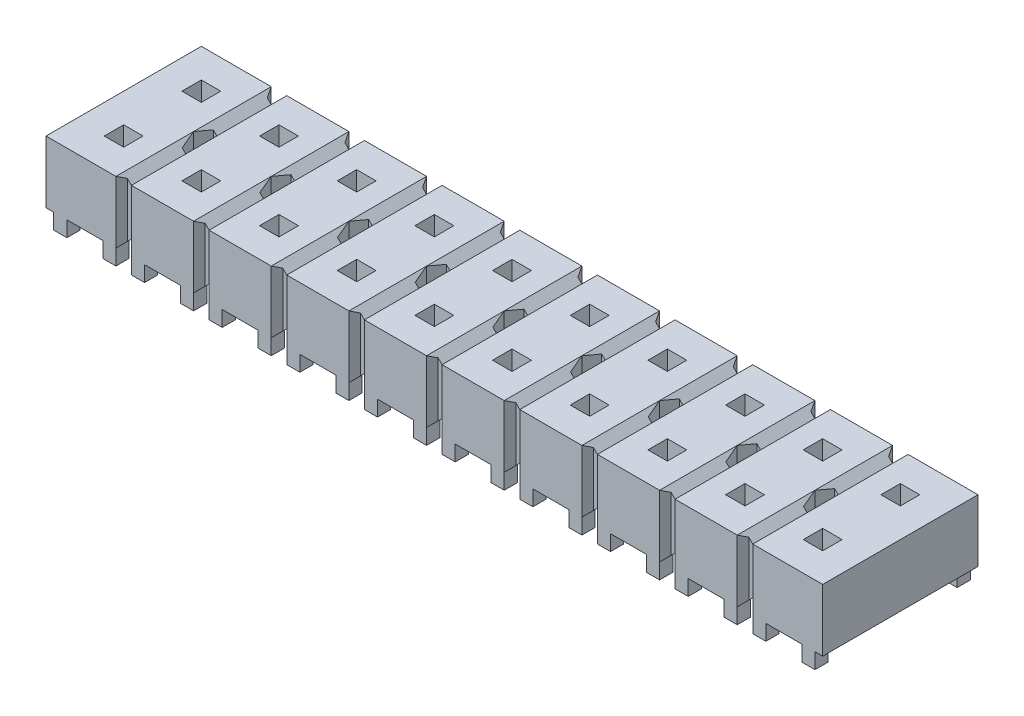
from build123d import *

# Parameters (mm, degrees)
CUT_EXTRUDE1_START     = -2.032
CUT_EXTRUDE1_OUTLINE_W = 0.635
CUT_EXTRUDE1_OUTLINE_H = 0.635
CUT_EXTRUDE1_DEPTH     = 2.032
CUT_EXTRUDE1_START_2   = -4
CUT_EXTRUDE1_2_DEPTH   = 8
SKETCH2_W              = 0.635
SKETCH2_H              = 0.635
CUT_EXTRUDE2_DEPTH     = 14.109943707
SKETCH3_W              = 0.635
SKETCH3_H              = 0.635
CUT_EXTRUDE3_DEPTH     = 14.109943707
SKETCH4_W              = 0.635
SKETCH4_H              = 0.635
CUT_EXTRUDE4_DEPTH     = 14.109943707
SKETCH5_W              = 0.635
SKETCH5_H              = 0.635
CUT_EXTRUDE5_DEPTH     = 14.109943707
SKETCH6_W              = 0.635
SKETCH6_H              = 0.635
CUT_EXTRUDE6_DEPTH     = 14.109943707
SKETCH7_W              = 0.635
SKETCH7_H              = 0.635
CUT_EXTRUDE7_DEPTH     = 14.109943707
SKETCH8_W              = 0.635
SKETCH8_H              = 0.635
CUT_EXTRUDE8_DEPTH     = 14.109943707
SKETCH9_W              = 0.635
SKETCH9_H              = 0.635
CUT_EXTRUDE9_DEPTH     = 14.109943707
SKETCH10_W             = 0.635
SKETCH10_H             = 0.635
CUT_EXTRUDE10_DEPTH    = 14.109943707
SKETCH11_W             = 0.635
SKETCH11_H             = 0.635
CUT_EXTRUDE11_DEPTH    = 14.109943707
SKETCH12_W             = 0.635
SKETCH12_H             = 0.635
CUT_EXTRUDE12_DEPTH    = 14.109943707
SKETCH13_W             = 0.635
SKETCH13_H             = 0.635
CUT_EXTRUDE13_DEPTH    = 14.109943707
SKETCH14_W             = 0.635
SKETCH14_H             = 0.635
CUT_EXTRUDE14_DEPTH    = 14.109943707
SKETCH15_W             = 0.635
SKETCH15_H             = 0.635
CUT_EXTRUDE15_DEPTH    = 14.109943707
SKETCH16_W             = 0.635
SKETCH16_H             = 0.635
CUT_EXTRUDE16_DEPTH    = 14.109943707
SKETCH17_W             = 0.635
SKETCH17_H             = 0.635
CUT_EXTRUDE17_DEPTH    = 14.109943707
SKETCH18_W             = 0.635
SKETCH18_H             = 0.635
CUT_EXTRUDE18_DEPTH    = 14.109943707
SKETCH19_W             = 0.635
SKETCH19_H             = 0.635
CUT_EXTRUDE19_DEPTH    = 14.109943707
SKETCH20_W             = 0.635
SKETCH20_H             = 0.635
CUT_EXTRUDE20_DEPTH    = 14.109943707
SKETCH21_W             = 0.428684182
SKETCH21_H             = 0.508
BOSS_EXTRUDE1_DEPTH    = 0.4318
SKETCH22_W             = 0.431799746
SKETCH22_H             = 0.4318
BOSS_EXTRUDE2_DEPTH    = 0.508
SKETCH23_W             = 0.428684182
SKETCH23_H             = 0.508
BOSS_EXTRUDE3_DEPTH    = 0.4318
SKETCH24_W             = 0.431799746
SKETCH24_H             = 0.4318
BOSS_EXTRUDE4_DEPTH    = 0.508
SKETCH25_W             = 0.428684182
SKETCH25_H             = 0.508
BOSS_EXTRUDE5_DEPTH    = 0.4318
SKETCH26_W             = 0.428683928
SKETCH26_H             = 0.508
BOSS_EXTRUDE6_DEPTH    = 0.4318
SKETCH27_W             = 0.428684182
SKETCH27_H             = 0.508
BOSS_EXTRUDE7_DEPTH    = 0.4318
SKETCH28_W             = 0.428683928
SKETCH28_H             = 0.508
BOSS_EXTRUDE8_DEPTH    = 0.4318
SKETCH29_W             = 0.428684182
SKETCH29_H             = 0.508
BOSS_EXTRUDE9_DEPTH    = 0.4318
SKETCH30_W             = 0.428683928
SKETCH30_H             = 0.508
BOSS_EXTRUDE10_DEPTH   = 0.4318
SKETCH31_W             = 0.428684182
SKETCH31_H             = 0.508
BOSS_EXTRUDE11_DEPTH   = 0.4318
SKETCH32_W             = 0.428683928
SKETCH32_H             = 0.508
BOSS_EXTRUDE12_DEPTH   = 0.4318
SKETCH33_W             = 0.428684182
SKETCH33_H             = 0.508
BOSS_EXTRUDE13_DEPTH   = 0.4318
SKETCH34_W             = 0.428683928
SKETCH34_H             = 0.508
BOSS_EXTRUDE14_DEPTH   = 0.4318
SKETCH35_W             = 0.428684182
SKETCH35_H             = 0.508
BOSS_EXTRUDE15_DEPTH   = 0.4318
SKETCH36_W             = 0.428683928
SKETCH36_H             = 0.508
BOSS_EXTRUDE16_DEPTH   = 0.4318
SKETCH37_W             = 0.428684182
SKETCH37_H             = 0.508
BOSS_EXTRUDE17_DEPTH   = 0.4318
SKETCH38_W             = 0.428683928
SKETCH38_H             = 0.508
BOSS_EXTRUDE18_DEPTH   = 0.4318
SKETCH39_W             = 0.428684182
SKETCH39_H             = 0.508
BOSS_EXTRUDE19_DEPTH   = 0.4318
SKETCH40_W             = 0.428683928
SKETCH40_H             = 0.508
BOSS_EXTRUDE20_DEPTH   = 0.4318
SKETCH41_W             = 0.428684182
SKETCH41_H             = 0.508
BOSS_EXTRUDE21_DEPTH   = 0.4318
SKETCH42_W             = 0.428683928
SKETCH42_H             = 0.508
BOSS_EXTRUDE22_DEPTH   = 0.4318
SKETCH43_W             = 0.428684182
SKETCH43_H             = 0.508
BOSS_EXTRUDE23_DEPTH   = 0.4318
SKETCH44_W             = 0.428683928
SKETCH44_H             = 0.508
BOSS_EXTRUDE24_DEPTH   = 0.4318
SKETCH45_W             = 0.428684182
SKETCH45_H             = 0.508
BOSS_EXTRUDE25_DEPTH   = 0.4318
SKETCH46_W             = 0.428683928
SKETCH46_H             = 0.508
BOSS_EXTRUDE26_DEPTH   = 0.4318
SKETCH47_W             = 0.428684182
SKETCH47_H             = 0.508
BOSS_EXTRUDE27_DEPTH   = 0.4318
SKETCH48_W             = 0.428683928
SKETCH48_H             = 0.508
BOSS_EXTRUDE28_DEPTH   = 0.4318
SKETCH49_W             = 0.428684182
SKETCH49_H             = 0.508
BOSS_EXTRUDE29_DEPTH   = 0.4318
SKETCH50_W             = 0.428683928
SKETCH50_H             = 0.508
BOSS_EXTRUDE30_DEPTH   = 0.4318
SKETCH51_W             = 0.428684182
SKETCH51_H             = 0.508
BOSS_EXTRUDE31_DEPTH   = 0.4318
SKETCH52_W             = 0.428683928
SKETCH52_H             = 0.508
BOSS_EXTRUDE32_DEPTH   = 0.4318
SKETCH53_W             = 0.428684182
SKETCH53_H             = 0.508
BOSS_EXTRUDE33_DEPTH   = 0.4318
SKETCH54_W             = 0.428683928
SKETCH54_H             = 0.508
BOSS_EXTRUDE34_DEPTH   = 0.4318
SKETCH55_W             = 0.428684182
SKETCH55_H             = 0.508
BOSS_EXTRUDE35_DEPTH   = 0.4318
SKETCH56_W             = 0.428683928
SKETCH56_H             = 0.508
BOSS_EXTRUDE36_DEPTH   = 0.4318
SKETCH57_W             = 0.4318
SKETCH57_H             = 0.4318
BOSS_EXTRUDE37_DEPTH   = 0.508
SKETCH58_W             = 0.428683928
SKETCH58_H             = 0.508
BOSS_EXTRUDE38_DEPTH   = 0.4318
SKETCH59_W             = 0.428683928
SKETCH59_H             = 0.508
BOSS_EXTRUDE39_DEPTH   = 0.4318
SKETCH60_W             = 0.4318
SKETCH60_H             = 0.4318
BOSS_EXTRUDE40_DEPTH   = 0.508
CHAMFER1_SIZE          = 0.296816803
CHAMFER1_EDGE_2_SIZE   = 0.296816803
CHAMFER1_EDGE_3_SIZE   = 0.296816803
CHAMFER1_EDGE_4_SIZE   = 0.296816803
CHAMFER1_EDGE_5_SIZE   = 0.296816803
CHAMFER1_EDGE_6_SIZE   = 0.296816803
CHAMFER1_EDGE_7_SIZE   = 0.296816803
CHAMFER1_EDGE_8_SIZE   = 0.296816803
CHAMFER1_EDGE_9_SIZE   = 0.296816803
CHAMFER1_EDGE_10_SIZE  = 0.296816803
CHAMFER1_EDGE_11_SIZE  = 0.296816803
CHAMFER1_EDGE_12_SIZE  = 0.296816803
CHAMFER1_EDGE_13_SIZE  = 0.296816803
CHAMFER1_EDGE_14_SIZE  = 0.296816803
CHAMFER1_EDGE_15_SIZE  = 0.296816803
CHAMFER1_EDGE_16_SIZE  = 0.296816803
CHAMFER1_EDGE_17_SIZE  = 0.296816803
CHAMFER1_EDGE_18_SIZE  = 0.296816803


with BuildPart() as part:
    # Cut-Extrude1: read off the stored shape, not the designer's step
    # Cut-Extrude1 outline → Cut-Extrude1 (new body)
    with BuildSketch(Plane(origin=(0, 2.54, 0), x_dir=(-1, 0, 0), z_dir=(0, 1, 0)).offset(CUT_EXTRUDE1_START)):
        Polygon((-10.414, 2.54), (-12.7, 2.54), (-12.7, -2.54), (-10.414, -2.54), (-10.16, -2.019222824), (-9.906, -2.54), (-7.874, -2.54), (-7.62, -2.019222824), (-7.366, -2.54), (-5.334, -2.54), (-5.08, -2.019222824), (-4.826, -2.54), (-2.794, -2.54), (-2.54, -2.019222824), (-2.286, -2.54), (-0.254, -2.54), (0, -2.019222824), (0.254, -2.54), (2.286, -2.54), (2.54, -2.019222824), (2.794, -2.54), (4.826, -2.54), (5.08, -2.019222824), (5.334, -2.54), (7.366, -2.54), (7.62, -2.019222824), (7.874, -2.54), (9.906, -2.54), (10.16, -2.019222824), (10.414, -2.54), (12.7, -2.54), (12.7, 2.54), (10.414, 2.54), (10.16, 2.019222824), (9.906, 2.54), (7.874, 2.54), (7.62, 2.019222824), (7.366, 2.54), (5.334, 2.54), (5.08, 2.019222824), (4.826, 2.54), (2.794, 2.54), (2.54, 2.019222824), (2.286, 2.54), (0.254, 2.54), (0, 2.019222824), (-0.254, 2.54), (-2.286, 2.54), (-2.54, 2.019222824), (-2.794, 2.54), (-4.826, 2.54), (-5.08, 2.019222824), (-5.334, 2.54), (-7.366, 2.54), (-7.62, 2.019222824), (-7.874, 2.54), (-9.906, 2.54), (-10.16, 2.019222824), align=None)
        Polygon((-10.414, 0), (-10.276840001, 0.508), (-10.043159999, 0.508), (-9.906, 0), (-10.043159999, -0.508), (-10.276840001, -0.508), align=None, mode=Mode.SUBTRACT)
        Polygon((-7.874, 0), (-7.736840001, 0.508), (-7.503159999, 0.508), (-7.366, 0), (-7.503159999, -0.508), (-7.736840001, -0.508), align=None, mode=Mode.SUBTRACT)
        Polygon((-5.334, 0), (-5.196840001, 0.508), (-4.963159999, 0.508), (-4.826, 0), (-4.963159999, -0.508), (-5.196840001, -0.508), align=None, mode=Mode.SUBTRACT)
        Polygon((-2.794, 0), (-2.656840001, 0.508), (-2.423159999, 0.508), (-2.286, 0), (-2.423159999, -0.508), (-2.656840001, -0.508), align=None, mode=Mode.SUBTRACT)
        Polygon((-0.254, 0), (-0.116840001, 0.508), (0.116840001, 0.508), (0.254, 0), (0.116840001, -0.508), (-0.116840001, -0.508), align=None, mode=Mode.SUBTRACT)
        Polygon((2.286, 0), (2.423159999, 0.508), (2.656840001, 0.508), (2.794, 0), (2.656840001, -0.508), (2.423159999, -0.508), align=None, mode=Mode.SUBTRACT)
        Polygon((4.826, 0), (4.963159999, 0.508), (5.196840001, 0.508), (5.334, 0), (5.196840001, -0.508), (4.963159999, -0.508), align=None, mode=Mode.SUBTRACT)
        Polygon((7.366, 0), (7.503159999, 0.508), (7.736840001, 0.508), (7.874, 0), (7.736840001, -0.508), (7.503159999, -0.508), align=None, mode=Mode.SUBTRACT)
        Polygon((10.043159999, 0.508), (10.276840001, 0.508), (10.414, 0), (10.276840001, -0.508), (10.043159999, -0.508), (9.906, 0), align=None, mode=Mode.SUBTRACT)
        with Locations((11.43, 1.27)):
            Rectangle(CUT_EXTRUDE1_OUTLINE_W, CUT_EXTRUDE1_OUTLINE_H, mode=Mode.SUBTRACT)
    extrude(amount=CUT_EXTRUDE1_DEPTH)

    # Cut-Extrude1 2 outline → Cut-Extrude1 2 (cut)
    with BuildSketch(Plane.XY.offset(CUT_EXTRUDE1_START_2)):
        Polygon((10.16, 0.762), (9.906, 0.508), (10.414, 0.508), align=None)
        Polygon((7.62, 0.762), (7.366, 0.508), (7.874, 0.508), align=None)
        Polygon((5.08, 0.762), (4.826, 0.508), (5.334, 0.508), align=None)
        Polygon((2.54, 0.762), (2.286, 0.508), (2.794, 0.508), align=None)
        Polygon((0, 0.762), (-0.254, 0.508), (0.254, 0.508), align=None)
        Polygon((-2.54, 0.762), (-2.794, 0.508), (-2.286, 0.508), align=None)
        Polygon((-5.08, 0.762), (-5.334, 0.508), (-4.826, 0.508), align=None)
        Polygon((-7.62, 0.762), (-7.874, 0.508), (-7.366, 0.508), align=None)
        Polygon((-10.16, 0.762), (-10.414, 0.508), (-9.906, 0.508), align=None)
        Polygon((-10.16, 2.286), (-9.906, 2.54), (-10.414, 2.54), align=None)
        Polygon((10.414, 2.54), (9.906, 2.54), (10.16, 2.286), align=None)
        Polygon((7.874, 2.54), (7.366, 2.54), (7.62, 2.286), align=None)
        Polygon((5.334, 2.54), (4.826, 2.54), (5.08, 2.286), align=None)
        Polygon((2.794, 2.54), (2.286, 2.54), (2.54, 2.286), align=None)
        Polygon((0.254, 2.54), (-0.254, 2.54), (0, 2.286), align=None)
        Polygon((-2.286, 2.54), (-2.794, 2.54), (-2.54, 2.286), align=None)
        Polygon((-4.826, 2.54), (-5.334, 2.54), (-5.08, 2.286), align=None)
        Polygon((-7.874, 2.54), (-7.62, 2.286), (-7.366, 2.54), align=None)
    extrude(amount=CUT_EXTRUDE1_2_DEPTH, mode=Mode.SUBTRACT)

    # Sketch2 → Cut-Extrude2 (cut, through all)
    with BuildSketch(Plane.XZ.offset(-0.508)):
        with Locations((-11.43, -1.27)):
            Rectangle(SKETCH2_W, SKETCH2_H)
    extrude(amount=-CUT_EXTRUDE2_DEPTH, mode=Mode.SUBTRACT)

    # Sketch3 → Cut-Extrude3 (cut, through all)
    with BuildSketch(Plane.XZ.offset(-0.508)):
        with Locations((-8.89, 1.27)):
            Rectangle(SKETCH3_W, SKETCH3_H)
    extrude(amount=-CUT_EXTRUDE3_DEPTH, mode=Mode.SUBTRACT)

    # Sketch4 → Cut-Extrude4 (cut, through all)
    with BuildSketch(Plane(origin=(0, 2.54, 0), x_dir=(-1, 0, 0), z_dir=(0, 1, 0))):
        with Locations((8.89, -1.27)):
            Rectangle(SKETCH4_W, SKETCH4_H)
    extrude(amount=-CUT_EXTRUDE4_DEPTH, mode=Mode.SUBTRACT)

    # Sketch5 → Cut-Extrude5 (cut, through all)
    with BuildSketch(Plane.XZ.offset(-0.508)):
        with Locations((-6.35, 1.27)):
            Rectangle(SKETCH5_W, SKETCH5_H)
    extrude(amount=-CUT_EXTRUDE5_DEPTH, mode=Mode.SUBTRACT)

    # Sketch6 → Cut-Extrude6 (cut, through all)
    with BuildSketch(Plane(origin=(0, 2.54, 0), x_dir=(-1, 0, 0), z_dir=(0, 1, 0))):
        with Locations((6.35, -1.27)):
            Rectangle(SKETCH6_W, SKETCH6_H)
    extrude(amount=-CUT_EXTRUDE6_DEPTH, mode=Mode.SUBTRACT)

    # Sketch7 → Cut-Extrude7 (cut, through all)
    with BuildSketch(Plane.XZ.offset(-0.508)):
        with Locations((-3.81, 1.27)):
            Rectangle(SKETCH7_W, SKETCH7_H)
    extrude(amount=-CUT_EXTRUDE7_DEPTH, mode=Mode.SUBTRACT)

    # Sketch8 → Cut-Extrude8 (cut, through all)
    with BuildSketch(Plane(origin=(0, 2.54, 0), x_dir=(-1, 0, 0), z_dir=(0, 1, 0))):
        with Locations((3.81, -1.27)):
            Rectangle(SKETCH8_W, SKETCH8_H)
    extrude(amount=-CUT_EXTRUDE8_DEPTH, mode=Mode.SUBTRACT)

    # Sketch9 → Cut-Extrude9 (cut, through all)
    with BuildSketch(Plane.XZ.offset(-0.508)):
        with Locations((-1.27, 1.27)):
            Rectangle(SKETCH9_W, SKETCH9_H)
    extrude(amount=-CUT_EXTRUDE9_DEPTH, mode=Mode.SUBTRACT)

    # Sketch10 → Cut-Extrude10 (cut, through all)
    with BuildSketch(Plane(origin=(0, 2.54, 0), x_dir=(-1, 0, 0), z_dir=(0, 1, 0))):
        with Locations((1.27, -1.27)):
            Rectangle(SKETCH10_W, SKETCH10_H)
    extrude(amount=-CUT_EXTRUDE10_DEPTH, mode=Mode.SUBTRACT)

    # Sketch11 → Cut-Extrude11 (cut, through all)
    with BuildSketch(Plane.XZ.offset(-0.508)):
        with Locations((1.27, 1.27)):
            Rectangle(SKETCH11_W, SKETCH11_H)
    extrude(amount=-CUT_EXTRUDE11_DEPTH, mode=Mode.SUBTRACT)

    # Sketch12 → Cut-Extrude12 (cut, through all)
    with BuildSketch(Plane(origin=(0, 2.54, 0), x_dir=(-1, 0, 0), z_dir=(0, 1, 0))):
        with Locations((-1.27, -1.27)):
            Rectangle(SKETCH12_W, SKETCH12_H)
    extrude(amount=-CUT_EXTRUDE12_DEPTH, mode=Mode.SUBTRACT)

    # Sketch13 → Cut-Extrude13 (cut, through all)
    with BuildSketch(Plane.XZ.offset(-0.508)):
        with Locations((3.81, 1.27)):
            Rectangle(SKETCH13_W, SKETCH13_H)
    extrude(amount=-CUT_EXTRUDE13_DEPTH, mode=Mode.SUBTRACT)

    # Sketch14 → Cut-Extrude14 (cut, through all)
    with BuildSketch(Plane(origin=(0, 2.54, 0), x_dir=(-1, 0, 0), z_dir=(0, 1, 0))):
        with Locations((-3.81, -1.27)):
            Rectangle(SKETCH14_W, SKETCH14_H)
    extrude(amount=-CUT_EXTRUDE14_DEPTH, mode=Mode.SUBTRACT)

    # Sketch15 → Cut-Extrude15 (cut, through all)
    with BuildSketch(Plane.XZ.offset(-0.508)):
        with Locations((6.35, 1.27)):
            Rectangle(SKETCH15_W, SKETCH15_H)
    extrude(amount=-CUT_EXTRUDE15_DEPTH, mode=Mode.SUBTRACT)

    # Sketch16 → Cut-Extrude16 (cut, through all)
    with BuildSketch(Plane(origin=(0, 2.54, 0), x_dir=(-1, 0, 0), z_dir=(0, 1, 0))):
        with Locations((-6.35, -1.27)):
            Rectangle(SKETCH16_W, SKETCH16_H)
    extrude(amount=-CUT_EXTRUDE16_DEPTH, mode=Mode.SUBTRACT)

    # Sketch17 → Cut-Extrude17 (cut, through all)
    with BuildSketch(Plane.XZ.offset(-0.508)):
        with Locations((8.89, 1.27)):
            Rectangle(SKETCH17_W, SKETCH17_H)
    extrude(amount=-CUT_EXTRUDE17_DEPTH, mode=Mode.SUBTRACT)

    # Sketch18 → Cut-Extrude18 (cut, through all)
    with BuildSketch(Plane(origin=(0, 2.54, 0), x_dir=(-1, 0, 0), z_dir=(0, 1, 0))):
        with Locations((-8.89, -1.27)):
            Rectangle(SKETCH18_W, SKETCH18_H)
    extrude(amount=-CUT_EXTRUDE18_DEPTH, mode=Mode.SUBTRACT)

    # Sketch19 → Cut-Extrude19 (cut, through all)
    with BuildSketch(Plane.XZ.offset(-0.508)):
        with Locations((11.43, 1.27)):
            Rectangle(SKETCH19_W, SKETCH19_H)
    extrude(amount=-CUT_EXTRUDE19_DEPTH, mode=Mode.SUBTRACT)

    # Sketch20 → Cut-Extrude20 (cut, through all)
    with BuildSketch(Plane(origin=(0, 2.54, 0), x_dir=(-1, 0, 0), z_dir=(0, 1, 0))):
        with Locations((-11.43, -1.27)):
            Rectangle(SKETCH20_W, SKETCH20_H)
    extrude(amount=-CUT_EXTRUDE20_DEPTH, mode=Mode.SUBTRACT)

    # Sketch21 → Boss-Extrude1 (add)
    with BuildSketch(Plane(origin=(0, 0, -2.54), x_dir=(-1, 0, 0), z_dir=(0, 0, -1))):
        with Locations((-10.628342091, 0.254)):
            Rectangle(SKETCH21_W, SKETCH21_H)
    extrude(amount=-BOSS_EXTRUDE1_DEPTH)

    # Sketch22 → Boss-Extrude2 (add)
    with BuildSketch(Plane.XZ.offset(-0.508)):
        with Locations((12.233215945, 2.3241)):
            Rectangle(SKETCH22_W, SKETCH22_H)
    extrude(amount=BOSS_EXTRUDE2_DEPTH)

    # Sketch23 → Boss-Extrude3 (add)
    with BuildSketch(Plane.XY.offset(2.54)):
        with Locations((10.628342091, 0.254)):
            Rectangle(SKETCH23_W, SKETCH23_H)
    extrude(amount=-BOSS_EXTRUDE3_DEPTH)

    # Sketch24 → Boss-Extrude4 (add)
    with BuildSketch(Plane.XZ.offset(-0.508)):
        with Locations((12.233215945, -2.3241)):
            Rectangle(SKETCH24_W, SKETCH24_H)
    extrude(amount=BOSS_EXTRUDE4_DEPTH)

    # Sketch25 → Boss-Extrude5 (add)
    with BuildSketch(Plane(origin=(0, 0, -2.54), x_dir=(-1, 0, 0), z_dir=(0, 0, -1))):
        with Locations((-8.088342091, 0.254)):
            Rectangle(SKETCH25_W, SKETCH25_H)
    extrude(amount=-BOSS_EXTRUDE5_DEPTH)

    # Sketch26 → Boss-Extrude6 (add)
    with BuildSketch(Plane.XY.offset(2.54)):
        with Locations((9.691658036, 0.254)):
            Rectangle(SKETCH26_W, SKETCH26_H)
    extrude(amount=-BOSS_EXTRUDE6_DEPTH)

    # Sketch27 → Boss-Extrude7 (add)
    with BuildSketch(Plane.XY.offset(2.54)):
        with Locations((8.088342091, 0.254)):
            Rectangle(SKETCH27_W, SKETCH27_H)
    extrude(amount=-BOSS_EXTRUDE7_DEPTH)

    # Sketch28 → Boss-Extrude8 (add)
    with BuildSketch(Plane(origin=(0, 0, -2.54), x_dir=(-1, 0, 0), z_dir=(0, 0, -1))):
        with Locations((-9.691658036, 0.254)):
            Rectangle(SKETCH28_W, SKETCH28_H)
    extrude(amount=-BOSS_EXTRUDE8_DEPTH)

    # Sketch29 → Boss-Extrude9 (add)
    with BuildSketch(Plane(origin=(0, 0, -2.54), x_dir=(-1, 0, 0), z_dir=(0, 0, -1))):
        with Locations((-5.548342091, 0.254)):
            Rectangle(SKETCH29_W, SKETCH29_H)
    extrude(amount=-BOSS_EXTRUDE9_DEPTH)

    # Sketch30 → Boss-Extrude10 (add)
    with BuildSketch(Plane.XY.offset(2.54)):
        with Locations((7.151658036, 0.254)):
            Rectangle(SKETCH30_W, SKETCH30_H)
    extrude(amount=-BOSS_EXTRUDE10_DEPTH)

    # Sketch31 → Boss-Extrude11 (add)
    with BuildSketch(Plane.XY.offset(2.54)):
        with Locations((5.548342091, 0.254)):
            Rectangle(SKETCH31_W, SKETCH31_H)
    extrude(amount=-BOSS_EXTRUDE11_DEPTH)

    # Sketch32 → Boss-Extrude12 (add)
    with BuildSketch(Plane(origin=(0, 0, -2.54), x_dir=(-1, 0, 0), z_dir=(0, 0, -1))):
        with Locations((-7.151658036, 0.254)):
            Rectangle(SKETCH32_W, SKETCH32_H)
    extrude(amount=-BOSS_EXTRUDE12_DEPTH)

    # Sketch33 → Boss-Extrude13 (add)
    with BuildSketch(Plane(origin=(0, 0, -2.54), x_dir=(-1, 0, 0), z_dir=(0, 0, -1))):
        with Locations((-3.008342091, 0.254)):
            Rectangle(SKETCH33_W, SKETCH33_H)
    extrude(amount=-BOSS_EXTRUDE13_DEPTH)

    # Sketch34 → Boss-Extrude14 (add)
    with BuildSketch(Plane.XY.offset(2.54)):
        with Locations((4.611658036, 0.254)):
            Rectangle(SKETCH34_W, SKETCH34_H)
    extrude(amount=-BOSS_EXTRUDE14_DEPTH)

    # Sketch35 → Boss-Extrude15 (add)
    with BuildSketch(Plane.XY.offset(2.54)):
        with Locations((3.008342091, 0.254)):
            Rectangle(SKETCH35_W, SKETCH35_H)
    extrude(amount=-BOSS_EXTRUDE15_DEPTH)

    # Sketch36 → Boss-Extrude16 (add)
    with BuildSketch(Plane(origin=(0, 0, -2.54), x_dir=(-1, 0, 0), z_dir=(0, 0, -1))):
        with Locations((-4.611658036, 0.254)):
            Rectangle(SKETCH36_W, SKETCH36_H)
    extrude(amount=-BOSS_EXTRUDE16_DEPTH)

    # Sketch37 → Boss-Extrude17 (add)
    with BuildSketch(Plane(origin=(0, 0, -2.54), x_dir=(-1, 0, 0), z_dir=(0, 0, -1))):
        with Locations((-0.468342091, 0.254)):
            Rectangle(SKETCH37_W, SKETCH37_H)
    extrude(amount=-BOSS_EXTRUDE17_DEPTH)

    # Sketch38 → Boss-Extrude18 (add)
    with BuildSketch(Plane.XY.offset(2.54)):
        with Locations((2.071658036, 0.254)):
            Rectangle(SKETCH38_W, SKETCH38_H)
    extrude(amount=-BOSS_EXTRUDE18_DEPTH)

    # Sketch39 → Boss-Extrude19 (add)
    with BuildSketch(Plane.XY.offset(2.54)):
        with Locations((0.468342091, 0.254)):
            Rectangle(SKETCH39_W, SKETCH39_H)
    extrude(amount=-BOSS_EXTRUDE19_DEPTH)

    # Sketch40 → Boss-Extrude20 (add)
    with BuildSketch(Plane(origin=(0, 0, -2.54), x_dir=(-1, 0, 0), z_dir=(0, 0, -1))):
        with Locations((-2.071658036, 0.254)):
            Rectangle(SKETCH40_W, SKETCH40_H)
    extrude(amount=-BOSS_EXTRUDE20_DEPTH)

    # Sketch41 → Boss-Extrude21 (add)
    with BuildSketch(Plane(origin=(0, 0, -2.54), x_dir=(-1, 0, 0), z_dir=(0, 0, -1))):
        with Locations((2.071657909, 0.254)):
            Rectangle(SKETCH41_W, SKETCH41_H)
    extrude(amount=-BOSS_EXTRUDE21_DEPTH)

    # Sketch42 → Boss-Extrude22 (add)
    with BuildSketch(Plane.XY.offset(2.54)):
        with Locations((-0.468341964, 0.254)):
            Rectangle(SKETCH42_W, SKETCH42_H)
    extrude(amount=-BOSS_EXTRUDE22_DEPTH)

    # Sketch43 → Boss-Extrude23 (add)
    with BuildSketch(Plane.XY.offset(2.54)):
        with Locations((-2.071657909, 0.254)):
            Rectangle(SKETCH43_W, SKETCH43_H)
    extrude(amount=-BOSS_EXTRUDE23_DEPTH)

    # Sketch44 → Boss-Extrude24 (add)
    with BuildSketch(Plane(origin=(0, 0, -2.54), x_dir=(-1, 0, 0), z_dir=(0, 0, -1))):
        with Locations((0.468341964, 0.254)):
            Rectangle(SKETCH44_W, SKETCH44_H)
    extrude(amount=-BOSS_EXTRUDE24_DEPTH)

    # Sketch45 → Boss-Extrude25 (add)
    with BuildSketch(Plane(origin=(0, 0, -2.54), x_dir=(-1, 0, 0), z_dir=(0, 0, -1))):
        with Locations((4.611657909, 0.254)):
            Rectangle(SKETCH45_W, SKETCH45_H)
    extrude(amount=-BOSS_EXTRUDE25_DEPTH)

    # Sketch46 → Boss-Extrude26 (add)
    with BuildSketch(Plane.XY.offset(2.54)):
        with Locations((-3.008341964, 0.254)):
            Rectangle(SKETCH46_W, SKETCH46_H)
    extrude(amount=-BOSS_EXTRUDE26_DEPTH)

    # Sketch47 → Boss-Extrude27 (add)
    with BuildSketch(Plane.XY.offset(2.54)):
        with Locations((-4.611657909, 0.254)):
            Rectangle(SKETCH47_W, SKETCH47_H)
    extrude(amount=-BOSS_EXTRUDE27_DEPTH)

    # Sketch48 → Boss-Extrude28 (add)
    with BuildSketch(Plane(origin=(0, 0, -2.54), x_dir=(-1, 0, 0), z_dir=(0, 0, -1))):
        with Locations((3.008341964, 0.254)):
            Rectangle(SKETCH48_W, SKETCH48_H)
    extrude(amount=-BOSS_EXTRUDE28_DEPTH)

    # Sketch49 → Boss-Extrude29 (add)
    with BuildSketch(Plane(origin=(0, 0, -2.54), x_dir=(-1, 0, 0), z_dir=(0, 0, -1))):
        with Locations((7.151657909, 0.254)):
            Rectangle(SKETCH49_W, SKETCH49_H)
    extrude(amount=-BOSS_EXTRUDE29_DEPTH)

    # Sketch50 → Boss-Extrude30 (add)
    with BuildSketch(Plane.XY.offset(2.54)):
        with Locations((-5.548341964, 0.254)):
            Rectangle(SKETCH50_W, SKETCH50_H)
    extrude(amount=-BOSS_EXTRUDE30_DEPTH)

    # Sketch51 → Boss-Extrude31 (add)
    with BuildSketch(Plane.XY.offset(2.54)):
        with Locations((-7.151657909, 0.254)):
            Rectangle(SKETCH51_W, SKETCH51_H)
    extrude(amount=-BOSS_EXTRUDE31_DEPTH)

    # Sketch52 → Boss-Extrude32 (add)
    with BuildSketch(Plane(origin=(0, 0, -2.54), x_dir=(-1, 0, 0), z_dir=(0, 0, -1))):
        with Locations((5.548341964, 0.254)):
            Rectangle(SKETCH52_W, SKETCH52_H)
    extrude(amount=-BOSS_EXTRUDE32_DEPTH)

    # Sketch53 → Boss-Extrude33 (add)
    with BuildSketch(Plane(origin=(0, 0, -2.54), x_dir=(-1, 0, 0), z_dir=(0, 0, -1))):
        with Locations((9.691657909, 0.254)):
            Rectangle(SKETCH53_W, SKETCH53_H)
    extrude(amount=-BOSS_EXTRUDE33_DEPTH)

    # Sketch54 → Boss-Extrude34 (add)
    with BuildSketch(Plane.XY.offset(2.54)):
        with Locations((-8.088341964, 0.254)):
            Rectangle(SKETCH54_W, SKETCH54_H)
    extrude(amount=-BOSS_EXTRUDE34_DEPTH)

    # Sketch55 → Boss-Extrude35 (add)
    with BuildSketch(Plane.XY.offset(2.54)):
        with Locations((-9.691657909, 0.254)):
            Rectangle(SKETCH55_W, SKETCH55_H)
    extrude(amount=-BOSS_EXTRUDE35_DEPTH)

    # Sketch56 → Boss-Extrude36 (add)
    with BuildSketch(Plane(origin=(0, 0, -2.54), x_dir=(-1, 0, 0), z_dir=(0, 0, -1))):
        with Locations((8.088341964, 0.254)):
            Rectangle(SKETCH56_W, SKETCH56_H)
    extrude(amount=-BOSS_EXTRUDE36_DEPTH)

    # Sketch57 → Boss-Extrude37 (add)
    with BuildSketch(Plane.XZ.offset(-0.508)):
        with Locations((-12.233215818, 2.3241)):
            Rectangle(SKETCH57_W, SKETCH57_H)
    extrude(amount=BOSS_EXTRUDE37_DEPTH)

    # Sketch58 → Boss-Extrude38 (add)
    with BuildSketch(Plane.XY.offset(2.54)):
        with Locations((-10.628341964, 0.254)):
            Rectangle(SKETCH58_W, SKETCH58_H)
    extrude(amount=-BOSS_EXTRUDE38_DEPTH)

    # Sketch59 → Boss-Extrude39 (add)
    with BuildSketch(Plane(origin=(0, 0, -2.54), x_dir=(-1, 0, 0), z_dir=(0, 0, -1))):
        with Locations((10.628341964, 0.254)):
            Rectangle(SKETCH59_W, SKETCH59_H)
    extrude(amount=-BOSS_EXTRUDE39_DEPTH)

    # Sketch60 → Boss-Extrude40 (add)
    with BuildSketch(Plane.XZ.offset(-0.508)):
        with Locations((-12.233215818, -2.3241)):
            Rectangle(SKETCH60_W, SKETCH60_H)
    extrude(amount=BOSS_EXTRUDE40_DEPTH)

    # Chamfer1
    chamfer1_edges = [part.edges().sort_by_distance(p)[0] for p in [
        (5.08, 1.524, -2.019222824),
    ]]
    chamfer(chamfer1_edges, length=CHAMFER1_SIZE)

    # Chamfer1 edge 2
    chamfer1_edge_2_edges = [part.edges().sort_by_distance(p)[0] for p in [
        (-5.08, 1.524, -2.019222824),
    ]]
    chamfer(chamfer1_edge_2_edges, length=CHAMFER1_EDGE_2_SIZE)

    # Chamfer1 edge 3
    chamfer1_edge_3_edges = [part.edges().sort_by_distance(p)[0] for p in [
        (-10.16, 1.524, -2.019222824),
    ]]
    chamfer(chamfer1_edge_3_edges, length=CHAMFER1_EDGE_3_SIZE)

    # Chamfer1 edge 4
    chamfer1_edge_4_edges = [part.edges().sort_by_distance(p)[0] for p in [
        (7.62, 1.524, 2.019222824),
    ]]
    chamfer(chamfer1_edge_4_edges, length=CHAMFER1_EDGE_4_SIZE)

    # Chamfer1 edge 5
    chamfer1_edge_5_edges = [part.edges().sort_by_distance(p)[0] for p in [
        (0, 1.524, -2.019222824),
    ]]
    chamfer(chamfer1_edge_5_edges, length=CHAMFER1_EDGE_5_SIZE)

    # Chamfer1 edge 6
    chamfer1_edge_6_edges = [part.edges().sort_by_distance(p)[0] for p in [
        (5.08, 1.524, 2.019222824),
    ]]
    chamfer(chamfer1_edge_6_edges, length=CHAMFER1_EDGE_6_SIZE)

    # Chamfer1 edge 7
    chamfer1_edge_7_edges = [part.edges().sort_by_distance(p)[0] for p in [
        (10.16, 1.524, -2.019222824),
    ]]
    chamfer(chamfer1_edge_7_edges, length=CHAMFER1_EDGE_7_SIZE)

    # Chamfer1 edge 8
    chamfer1_edge_8_edges = [part.edges().sort_by_distance(p)[0] for p in [
        (2.54, 1.524, 2.019222824),
    ]]
    chamfer(chamfer1_edge_8_edges, length=CHAMFER1_EDGE_8_SIZE)

    # Chamfer1 edge 9
    chamfer1_edge_9_edges = [part.edges().sort_by_distance(p)[0] for p in [
        (-7.62, 1.524, -2.019222824),
    ]]
    chamfer(chamfer1_edge_9_edges, length=CHAMFER1_EDGE_9_SIZE)

    # Chamfer1 edge 10
    chamfer1_edge_10_edges = [part.edges().sort_by_distance(p)[0] for p in [
        (0, 1.524, 2.019222824),
    ]]
    chamfer(chamfer1_edge_10_edges, length=CHAMFER1_EDGE_10_SIZE)

    # Chamfer1 edge 11
    chamfer1_edge_11_edges = [part.edges().sort_by_distance(p)[0] for p in [
        (-2.54, 1.524, -2.019222824),
    ]]
    chamfer(chamfer1_edge_11_edges, length=CHAMFER1_EDGE_11_SIZE)

    # Chamfer1 edge 12
    chamfer1_edge_12_edges = [part.edges().sort_by_distance(p)[0] for p in [
        (-2.54, 1.524, 2.019222824),
    ]]
    chamfer(chamfer1_edge_12_edges, length=CHAMFER1_EDGE_12_SIZE)

    # Chamfer1 edge 13
    chamfer1_edge_13_edges = [part.edges().sort_by_distance(p)[0] for p in [
        (2.54, 1.524, -2.019222824),
    ]]
    chamfer(chamfer1_edge_13_edges, length=CHAMFER1_EDGE_13_SIZE)

    # Chamfer1 edge 14
    chamfer1_edge_14_edges = [part.edges().sort_by_distance(p)[0] for p in [
        (-5.08, 1.524, 2.019222824),
    ]]
    chamfer(chamfer1_edge_14_edges, length=CHAMFER1_EDGE_14_SIZE)

    # Chamfer1 edge 15
    chamfer1_edge_15_edges = [part.edges().sort_by_distance(p)[0] for p in [
        (7.62, 1.524, -2.019222824),
    ]]
    chamfer(chamfer1_edge_15_edges, length=CHAMFER1_EDGE_15_SIZE)

    # Chamfer1 edge 16
    chamfer1_edge_16_edges = [part.edges().sort_by_distance(p)[0] for p in [
        (-7.62, 1.524, 2.019222824),
    ]]
    chamfer(chamfer1_edge_16_edges, length=CHAMFER1_EDGE_16_SIZE)

    # Chamfer1 edge 17
    chamfer1_edge_17_edges = [part.edges().sort_by_distance(p)[0] for p in [
        (10.16, 1.524, 2.019222824),
    ]]
    chamfer(chamfer1_edge_17_edges, length=CHAMFER1_EDGE_17_SIZE)

    # Chamfer1 edge 18
    chamfer1_edge_18_edges = [part.edges().sort_by_distance(p)[0] for p in [
        (-10.16, 1.524, 2.019222824),
    ]]
    chamfer(chamfer1_edge_18_edges, length=CHAMFER1_EDGE_18_SIZE)


solid = part.part
